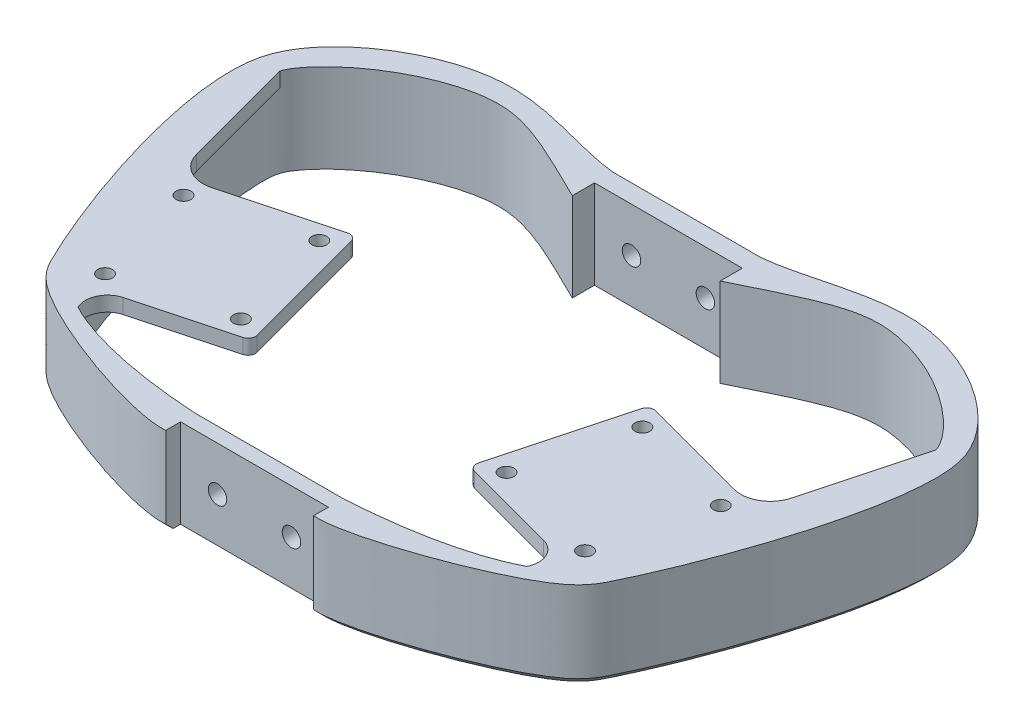
from build123d import *

# Parameters (mm, degrees)
EXTRUDE_1_DEPTH     = 12
EXTRUDE_2_DEPTH     = 2
SKETCH_12_R         = 1.25
CUT_EXTRUDE_5_DEPTH = 84.476530944
SKETCH_13_R         = 1
CUT_EXTRUDE_6_DEPTH = 10
CHAMFER_2_SIZE      = 1
EXTRUDE_START       = 2
SKETCH_14_R         = 1.25
EXTRUDE_3_DEPTH     = 2
FILLET_START        = -13.528168025
FILLET_1_DEPTH      = 10
FILLET_1_2_ANGLE    = 180
FILLET_1_3_ANGLE    = 180


with BuildPart() as part:
    # Эскиз1 → Бобышка-Вытянуть1 (new body)
    with BuildSketch(Plane(origin=(0, 0, 0), x_dir=(1, 0, 0), z_dir=(0, 1, 0))):
        with BuildLine():
            Line((-8.528168025, 70.65310685), (-8.528168025, 68.15310685))
            Line((-8.528168025, 68.15310685), (-18.528168025, 68.15310685))
            Line((-18.528168025, 68.15310685), (-18.528168025, 65.15310685))
            add(Edge.make_bspline(
                [(-18.528168025, 14.15310685), (-27.65166642, 14.68223007), (-39.654304917, 17.222161201), (-49.069688193, 29.72772513), (-54.020007958, 56.339325233), (-52.300748379, 62.396399732), (-44.815413912, 68.951652348), (-31.829520312, 71.857255162), (-26.640142813, 69.125445853), (-18.528168025, 65.15310685)],
                knots=[0, 0, 0, 0, 0.169508917, 0.22565782, 0.52417445, 0.588058089, 0.800610575, 0.844461672, 1, 1, 1, 1], degree=3))
            Line((-18.528168025, 14.15310685), (-8.528168025, 14.15310685))
            Line((-8.528168025, 14.15310685), (-8.528168025, 12.15310685))
            Line((-8.528168025, 12.15310685), (-18.528168025, 12.15310685))
            Line((-18.528168025, 12.15310685), (-18.528168025, 10.15310685))
            add(Edge.make_bspline(
                [(-18.528168025, 10.15310685), (-23.033807105, 9.738315153), (-43.406657475, 16.924930327), (-49.613524503, 28.683045665), (-57.343314717, 50.210506324), (-55.219601974, 66.129758543), (-37.439448649, 77.632588516), (-24.285507973, 71.251324679), (-18.528168025, 70.65310685)],
                knots=[0, 0, 0, 0, 0.145181214, 0.201011, 0.518599321, 0.583098526, 0.806304508, 1, 1, 1, 1], degree=3))
            Line((-18.528168025, 70.65310685), (-8.528168025, 70.65310685))
        make_face()
    extrude(amount=EXTRUDE_1_DEPTH)

    # Эскиз6 → Бобышка-Вытянуть2 (add)
    with BuildSketch(Plane(origin=(0, 12, 0), x_dir=(1, 0, 0), z_dir=(0, 1, 0))):
        with BuildLine():
            ThreePointArc((-38.902633132, 18.645972894), (-38.920312818, 21.194190177), (-36.972011488, 22.836702222))
            Line((-36.972011488, 22.836702222), (-24.206335653, 26.257254753))
            ThreePointArc((-24.206335653, 26.257254753), (-23.599129295, 26.723180579), (-23.499228872, 27.481999624))
            Line((-23.499228872, 27.481999624), (-28.157971684, 44.868664497))
            ThreePointArc((-28.157971684, 44.868664497), (-28.62389751, 45.475870856), (-29.382716555, 45.575771279))
            Line((-29.382716555, 45.575771279), (-43.87160395, 41.693485602))
            ThreePointArc((-43.87160395, 41.693485602), (-46.90688013, 42.093087292), (-48.770583435, 44.521912727))
            Line((-48.770583435, 44.521912727), (-52.911688157, 59.976725947))
            add(Edge.make_bspline(
                [(-38.902633132, 18.645972894), (-39.756895385, 19.096801722), (-42.247820138, 20.666882403), (-49.069688193, 29.72772513), (-53.705766872, 54.650048881), (-53.066369993, 59.494046563), (-52.911688157, 59.976725947)],
                knots=[0.144386519, 0.144386519, 0.144386519, 0.144386519, 0.169508917, 0.22565782, 0.52417445, 0.561489028, 0.561489028, 0.561489028, 0.561489028], degree=3))
        make_face()
    extrude(amount=-EXTRUDE_2_DEPTH)

    # Эскиз12 → Вырез-Вытянуть5 (cut, through all)
    with BuildSketch(Plane(origin=(0, 0, -70.65310685), x_dir=(-1, 0, 0), z_dir=(0, 0, -1))):
        with Locations((13.528168025, 6)):
            Circle(SKETCH_12_R)
    extrude(amount=-CUT_EXTRUDE_5_DEPTH, mode=Mode.SUBTRACT)

    # Эскиз13 → Вырез-Вытянуть6 (cut)
    with BuildSketch(Plane(origin=(0, 10, 0), x_dir=(-1, 0, 0), z_dir=(0, -1, 0))):
        with Locations(Location((30.379918449, 42.772728145, 0), (0, 0, 90))):
            Circle(SKETCH_13_R)
        with Locations(Location((26.497632772, 28.283840751, 0), (0, 0, 90))):
            Circle(SKETCH_13_R)
        with Locations(Location((40.986520167, 24.401555074, 0), (0, 0, 90))):
            Circle(SKETCH_13_R)
        with Locations(Location((44.868805843, 38.890442469, 0), (0, 0, 90))):
            Circle(SKETCH_13_R)
    extrude(amount=-CUT_EXTRUDE_6_DEPTH, mode=Mode.SUBTRACT)

    # Зеркальное отражение1: part across plane


with BuildPart() as part_1:
    add(part.part)
    add(part.part.mirror(Plane(origin=(-8.528168025, 12, 0), x_dir=(0, 0, 1), z_dir=(1, 0, 0))))

    # Фаска2
    chamfer_2_edges = [part_1.edges().sort_by_distance(p)[0] for p in [
        (-8.528168025, 0, -70.65310685),
        (-54.872086349, 0, -46.641692544),
        (37.815750299, 0, -46.641692544),
    ]]
    chamfer(chamfer_2_edges, length=CHAMFER_2_SIZE)

    # Эскиз14 → Бобышка-Вытянуть3 (add)
    with BuildSketch(Plane(origin=(0, 0, -14.15310685), x_dir=(-1, 0, 0), z_dir=(0, 0, -1)).offset(EXTRUDE_START)):
        with BuildLine():
            Line((13.528168025, 3.5), (3.528168025, 3.5))
            ThreePointArc((3.528168025, 3.5), (1.028168025, 6), (3.528168025, 8.5))
            Line((3.528168025, 8.5), (13.528168025, 8.5))
            ThreePointArc((13.528168025, 8.5), (16.028168025, 6), (13.528168025, 3.5))
        make_face()
        with Locations((13.528168025, 6)):
            Circle(SKETCH_14_R, mode=Mode.SUBTRACT)
        with Locations(Location((3.528168025, 6, 0), (0, 0, 180))):
            Circle(SKETCH_14_R, mode=Mode.SUBTRACT)
    extrude(amount=-EXTRUDE_3_DEPTH)

    # Скругление1: read off the stored shape, not the designer's step
    # Скругление1 outline → Скругление1 (add)
    with BuildSketch(Plane.YZ.offset(FILLET_START)):
        with BuildLine():
            Line((3.5, -14.15310685), (1.050510257, -14.15310685))
            ThreePointArc((1.050510257, -14.15310685), (2.631649088, -14.716615176), (3.5, -16.15310685))
            Line((3.5, -16.15310685), (3.5, -14.15310685))
        make_face()
        with BuildLine():
            Line((10.949489743, -14.15310685), (8.5, -14.15310685))
            Line((8.5, -14.15310685), (8.5, -16.15310685))
            ThreePointArc((8.5, -16.15310685), (9.368350912, -14.716615176), (10.949489743, -14.15310685))
        make_face()
    extrude(amount=FILLET_1_DEPTH)

    # Fillet 1 2 outline → Fillet 1 2 (revolve)
    with BuildSketch(Plane(origin=(-3.528168025, 6, 0), x_dir=(0, -1, 0), z_dir=(-1, 0, 0))):
        with BuildLine():
            ThreePointArc((2.5, -16.15310685), (3.368350912, -14.716615176), (4.949489743, -14.15310685))
            Line((4.949489743, -14.15310685), (2.5, -14.15310685))
            Line((2.5, -14.15310685), (2.5, -16.15310685))
        make_face()
    revolve(axis=Axis((-3.528168025, 6, 0), (0, 0, 1)), revolution_arc=FILLET_1_2_ANGLE)

    # Fillet 1 3 outline → Fillet 1 3 (revolve)
    with BuildSketch(Plane(origin=(-13.528168025, 6, 0), x_dir=(0, 1, 0), z_dir=(1, 0, 0))):
        with BuildLine():
            ThreePointArc((2.5, -16.15310685), (3.368350912, -14.716615176), (4.949489743, -14.15310685))
            Line((4.949489743, -14.15310685), (2.5, -14.15310685))
            Line((2.5, -14.15310685), (2.5, -16.15310685))
        make_face()
    revolve(axis=Axis((-13.528168025, 6, 0), (0, 0, 1)), revolution_arc=FILLET_1_3_ANGLE)


solid = part_1.part
